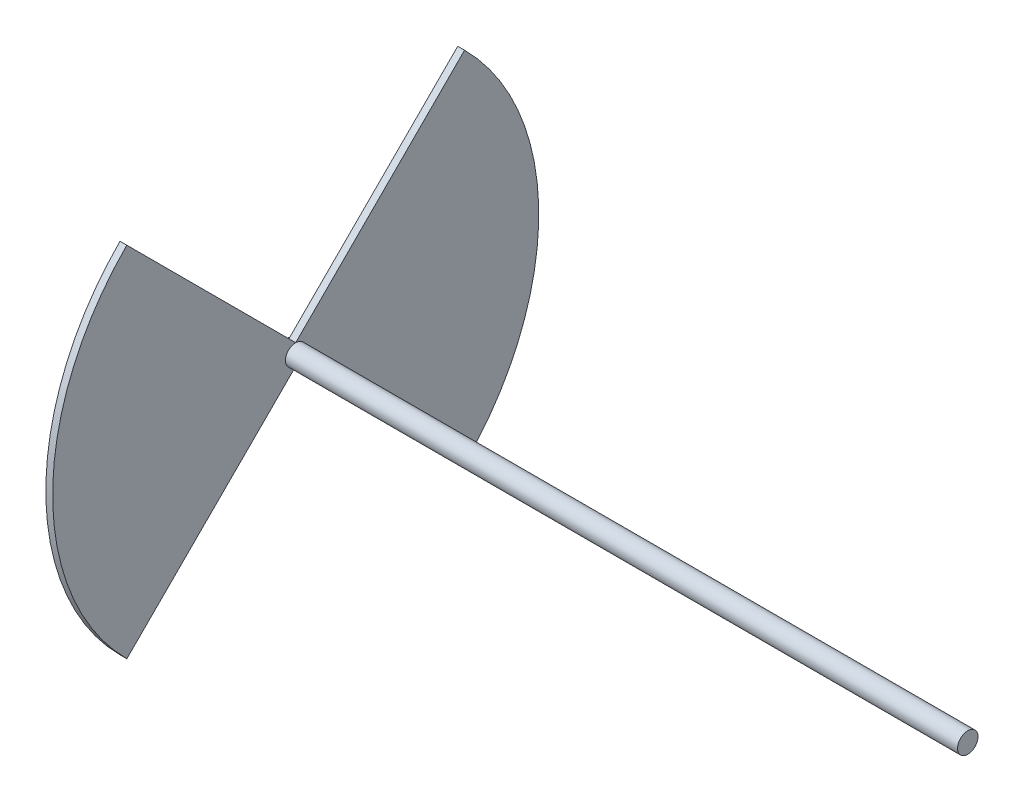
from build123d import *

# Parameters (mm, degrees)
ESBO_O2_R                = 2.5
RESSALTO_EXTRUS_O1_DEPTH = 2


with BuildPart() as part:
    # Esboço1 → Revolução1 (revolve)
    with BuildSketch(Plane.XY):
        Polygon((0, 2.5), (3, 2.5), (3, 3), (200, 3), (200, 0), (0, 0), align=None)
    revolve(axis=Axis((0, 0, 0), (1, 0, 0)))


with BuildPart() as body_2:
    # Esboço2 → Ressalto-extrusão1 (new body)
    with BuildSketch(Plane.ZY.offset(-3)):
        with BuildLine():
            Line((0, 3), (49.497474683, 52.497474683))
            ThreePointArc((49.497474683, 52.497474683), (71.242640687, 0), (49.497474683, -52.497474683))
            Line((49.497474683, -52.497474683), (0, -3))
            Line((0, -3), (-49.497474683, -52.497474683))
            ThreePointArc((-49.497474683, -52.497474683), (-71.242640687, 0), (-49.497474683, 52.497474683))
            Line((-49.497474683, 52.497474683), (0, 3))
        make_face()
        Circle(ESBO_O2_R, mode=Mode.SUBTRACT)
    extrude(amount=RESSALTO_EXTRUS_O1_DEPTH)


solid = Compound([part.part, body_2.part])
